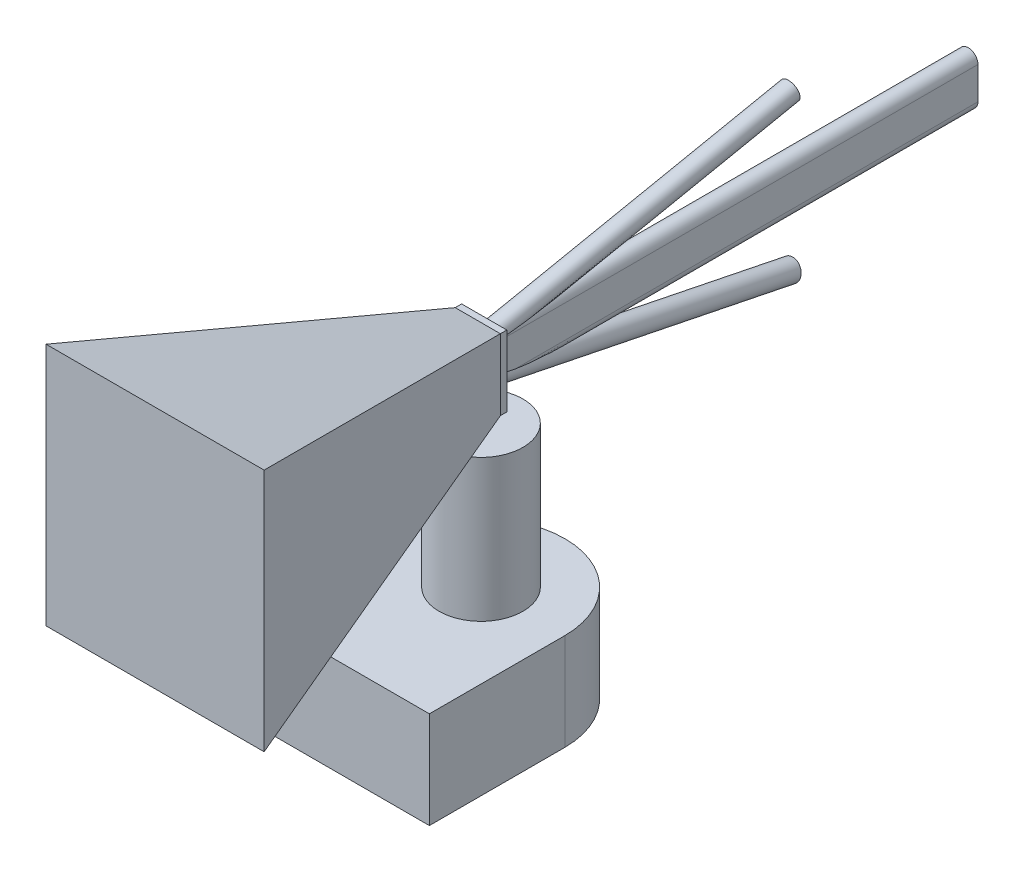
from build123d import *

# Parameters (mm, degrees)
BOSS_EXTRUDE1_DEPTH = 15
SKETCH2_R           = 6.5
BOSS_EXTRUDE2_DEPTH = 22
SKETCH3_R           = 1
BOSS_EXTRUDE3_DEPTH = 3
SKETCH4_W           = 7
SKETCH4_H           = 1
BOSS_EXTRUDE4_DEPTH = 11
SKETCH5_R           = 1.5
BOSS_EXTRUDE5_DEPTH = 20
BOSS_EXTRUDE6_DEPTH = 75
SKETCH7_R           = 1.589398049
BOSS_EXTRUDE7_DEPTH = 50
SKETCH8_R           = 1.5
BOSS_EXTRUDE8_DEPTH = 50
SKETCH9_W           = 7
SKETCH9_H           = 11
BOSS_EXTRUDE9_DEPTH = 50
BOSS_EXTRUDE9_TAPER = -15


with BuildPart() as part:
    # Sketch1 → Boss-Extrude1 (new body)
    with BuildSketch(Plane(origin=(0, 0, 0), x_dir=(1, 0, 0), z_dir=(0, 1, 0))):
        with BuildLine():
            Line((-13, 0), (-13, -21))
            Line((-13, -21), (13, -21))
            Line((13, -21), (13, 0))
            ThreePointArc((13, 0), (0, 13), (-13, 0))
        make_face()
    extrude(amount=BOSS_EXTRUDE1_DEPTH)

    # Sketch2 → Boss-Extrude2 (add)
    with BuildSketch(Plane(origin=(0, 15, 0), x_dir=(1, 0, 0), z_dir=(0, 1, 0))):
        Circle(SKETCH2_R)
    extrude(amount=BOSS_EXTRUDE2_DEPTH)

    # Sketch3 → Boss-Extrude3 (add)
    with BuildSketch(Plane(origin=(0, 37, 0), x_dir=(1, 0, 0), z_dir=(0, 1, 0))):
        Circle(SKETCH3_R)
    extrude(amount=BOSS_EXTRUDE3_DEPTH)

    # Sketch4 → Boss-Extrude4 (add)
    with BuildSketch(Plane(origin=(0, 40, 0), x_dir=(1, 0, 0), z_dir=(0, 1, 0))):
        Rectangle(SKETCH4_W, SKETCH4_H)
    extrude(amount=BOSS_EXTRUDE4_DEPTH)

    # Sketch5 → Boss-Extrude5 (add)
    with BuildSketch(Plane.XY.offset(0.5)):
        with Locations((0, 45.870127471)):
            Circle(SKETCH5_R)
    extrude(amount=BOSS_EXTRUDE5_DEPTH)

    # Sketch6 → Boss-Extrude6 (add)
    with BuildSketch(Plane(origin=(0, 0, -0.5), x_dir=(-1, 0, 0), z_dir=(0, 0, -1))):
        with BuildLine():
            Line((1.5, 48.124460967), (1.5, 43.124460967))
            ThreePointArc((1.5, 43.124460967), (0, 41.624460967), (-1.5, 43.124460967))
            Line((-1.5, 43.124460967), (-1.5, 48.124460967))
            ThreePointArc((-1.5, 48.124460967), (0, 49.624460967), (1.5, 48.124460967))
        make_face()
    extrude(amount=BOSS_EXTRUDE6_DEPTH)


with BuildPart() as boss_extrude7_tool:
    # Sketch7 → Boss-Extrude7 (new body)
    with BuildSketch(Plane(origin=(0, 1.929443455, 9.483517563), x_dir=(-1, 0, 0), z_dir=(0, -0.1993679344171976, -0.9799247046208295))):
        with Locations((0, 42.477919634)):
            Circle(SKETCH7_R)
    extrude(amount=BOSS_EXTRUDE7_DEPTH)


with BuildPart() as part_1:
    add(part.part)


with BuildPart() as part_2:
    # Boss-Extrude7: joined with boss_extrude7_tool
    add(part_1.part.fuse(boss_extrude7_tool.part, tol=0.00001))

    # Sketch8 → Boss-Extrude8 (add)
    with BuildSketch(Plane(origin=(0, 1.687585713, -8.294748783), x_dir=(-1, 0, 0), z_dir=(0, 0.1993679344171843, -0.9799247046208323))):
        with Locations((0, 47.019713669)):
            Circle(SKETCH8_R)
    extrude(amount=BOSS_EXTRUDE8_DEPTH)

    # Sketch9 → Boss-Extrude9 (add)
    with BuildSketch(Plane.XY.offset(0.5)):
        with Locations((0, 45.5)):
            Rectangle(SKETCH9_W, SKETCH9_H)
    extrude(amount=BOSS_EXTRUDE9_DEPTH, taper=BOSS_EXTRUDE9_TAPER)


solid = part_2.part
